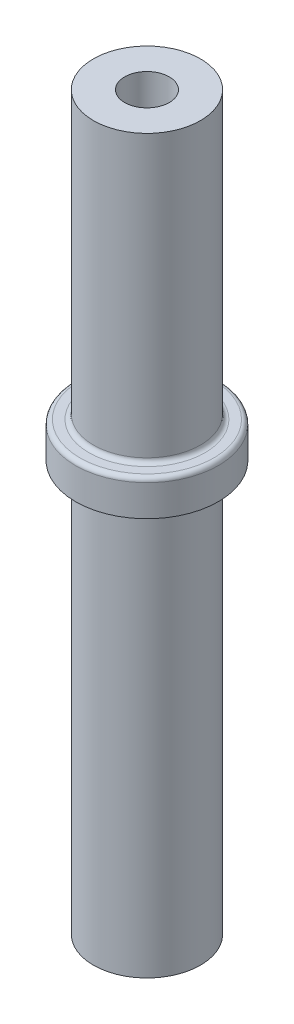
from build123d import *

# Parameters (mm, degrees)
BOSS_EXTRUDE1_DEPTH      = 20.5
BOSS_EXTRUDE1_DEPTH_BACK = 20.5
SKETCH1_R                = 3
SKETCH6_R                = 4
BOSS_EXTRUDE2_DEPTH      = 2
FILLET1_R                = 0.25


with BuildPart() as part:
    # Sketch1 → Boss-Extrude1 (new, two sides: drawn at the far end of the back side and taken through both)
    with BuildSketch(Plane(origin=(0, 0, 0), x_dir=(1, 0, 0), z_dir=(0, 1, 0)).offset(-BOSS_EXTRUDE1_DEPTH_BACK)):
        Circle(SKETCH1_R)
    extrude(amount=BOSS_EXTRUDE1_DEPTH + BOSS_EXTRUDE1_DEPTH_BACK)

    # Sketch5 → M3x0.5 Tapped Hole1 (revolve, cut)
    with BuildSketch(Plane(origin=(0, 20.5, 0), x_dir=(0, 0, 1), z_dir=(1, 0, 0))):
        Polygon((0, 0), (0, 8.751075774), (1.25, 8), (1.25, 0), align=None)
    m3x0_5_tapped_hole1 = revolve(axis=Axis((0, 26.85, 0), (0, -1, 0)), mode=Mode.SUBTRACT)

    # Sketch6 → Boss-Extrude2 (add)
    with BuildSketch(Plane(origin=(0, 2.5, 0), x_dir=(1, 0, 0), z_dir=(0, 1, 0))):
        Circle(SKETCH6_R)
    extrude(amount=BOSS_EXTRUDE2_DEPTH)

    # Mirror1: M3x0.5 Tapped Hole1 across plane
    add(m3x0_5_tapped_hole1.mirror(Plane.ZX), mode=Mode.SUBTRACT)

    # Fillet1
    fillet1_edges = [part.edges().sort_by_distance(p)[0] for p in [
        (-4, 4.5, 0),
        (-3, 4.5, 0),
    ]]
    fillet(fillet1_edges, radius=FILLET1_R)


solid = part.part
